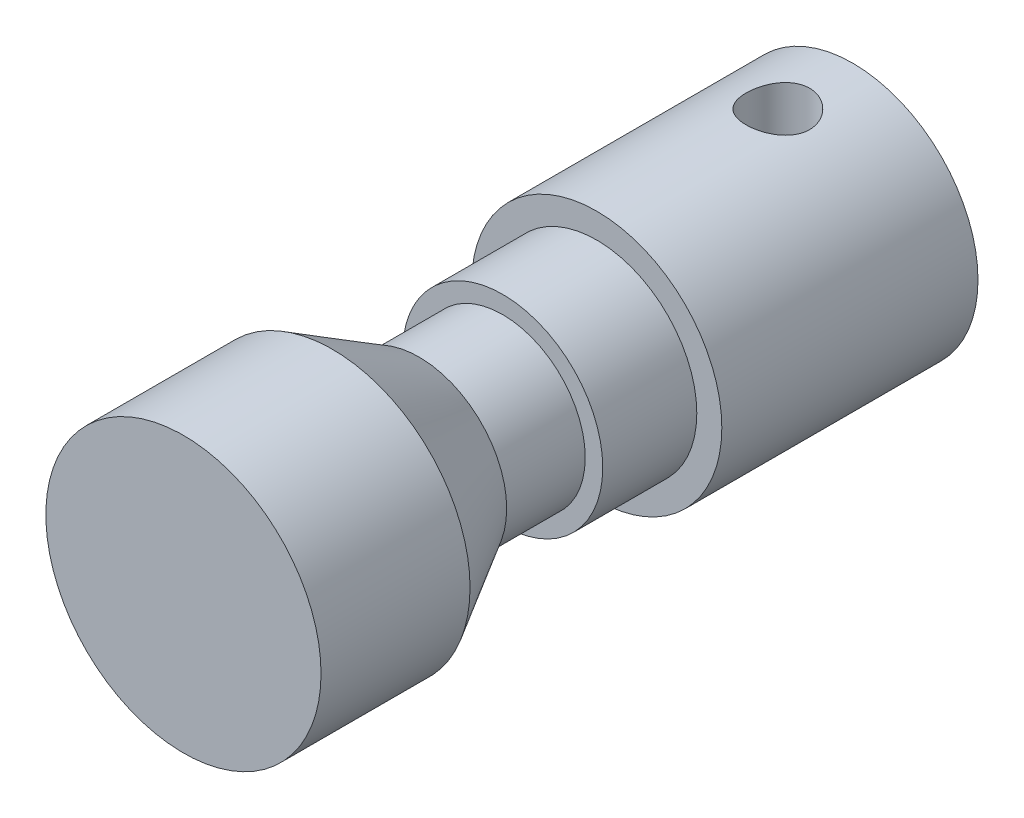
from build123d import *

# Parameters (mm, degrees)
ESQUISSE1_R                  = 25
BOSS_EXTRU_1_DEPTH           = 51.2
ESQUISSE2_R                  = 20
BOSS_EXTRU_2_DEPTH           = 18.8
ESQUISSE3_R                  = 16.5
BOSS_EXTRU_3_DEPTH           = 16.7
ESQUISSE4_R                  = 27.5
BOSS_EXTRU_4_DEPTH           = 47.1
CHANFREIN1_SIZE              = 10
CHANFREIN1_SIZE2             = 17.320508076
ENL_V_MAT_EXTRU_1_DEPTH      = 140.337503925
ENL_V_MAT_EXTRU_1_DEPTH_BACK = 140.337503925
ESQUISSE12_R                 = 6.35


with BuildPart() as part:
    # Esquisse1 → Boss.-Extru.1 (new body)
    with BuildSketch(Plane.XY):
        Circle(ESQUISSE1_R)
    extrude(amount=BOSS_EXTRU_1_DEPTH)

    # Esquisse2 → Boss.-Extru.2 (add)
    with BuildSketch(Plane.XY.offset(51.2)):
        Circle(ESQUISSE2_R)
    extrude(amount=BOSS_EXTRU_2_DEPTH)

    # Esquisse3 → Boss.-Extru.3 (add)
    with BuildSketch(Plane.XY.offset(70)):
        Circle(ESQUISSE3_R)
    extrude(amount=BOSS_EXTRU_3_DEPTH)

    # Esquisse4 → Boss.-Extru.4 (add)
    with BuildSketch(Plane.XY.offset(86.7)):
        Circle(ESQUISSE4_R)
    extrude(amount=BOSS_EXTRU_4_DEPTH)

    # Chanfrein1
    chanfrein1_edges = [part.edges().sort_by_distance(p)[0] for p in [
        (-27.5, 0, 86.7),
    ]]
    chanfrein1_side = [part.faces().sort_by_distance(p)[0] for p in [
        (-26.722182541, 0, 86.7),
    ]]
    chamfer(chanfrein1_edges, length=CHANFREIN1_SIZE, length2=CHANFREIN1_SIZE2, reference=chanfrein1_side[0])

    # Esquisse12 → Enlèv. mat.-Extru.1 (cut, two sides: drawn at the far end of the back side and taken through both)
    with BuildSketch(Plane(origin=(0, 0, 0), x_dir=(1, 0, 0), z_dir=(0, 1, 0)).offset(-ENL_V_MAT_EXTRU_1_DEPTH_BACK)):
        with Locations((0, -15)):
            Circle(ESQUISSE12_R)
    extrude(amount=ENL_V_MAT_EXTRU_1_DEPTH + ENL_V_MAT_EXTRU_1_DEPTH_BACK, mode=Mode.SUBTRACT)


solid = part.part
